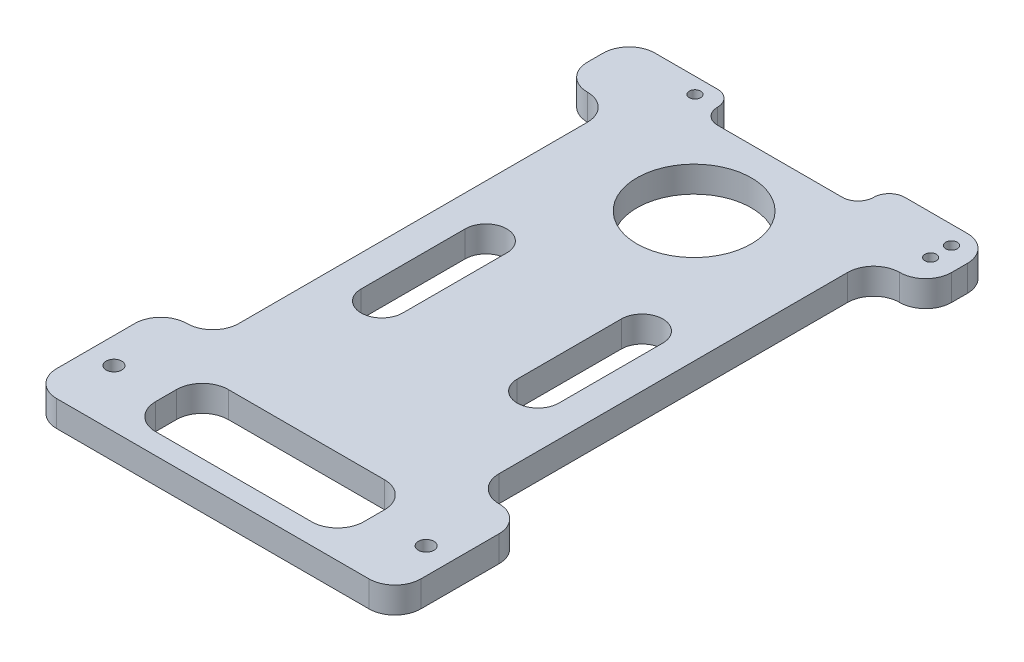
from build123d import *

# Parameters (mm, degrees)
SKETCH_1_W          = 70
SKETCH_1_H          = 115
SKETCH_1_R          = 1.5
SKETCH_1_R_2        = 1.1
SKETCH_1_R_3        = 11
SKETCH_1_W_2        = 40
SKETCH_1_H_2        = 14
EXTRUDE_1_DEPTH     = 5
FILLET_1_R          = 5
FILLET_2_R          = 5
SKETCH_3_W          = 30
SKETCH_3_H          = 6
SKETCH_3_W_2        = 10
SKETCH_3_H_2        = 77
CUT_EXTRUDE_1_DEPTH = 5
FILLET_START        = -1
FILLET_4_DEPTH      = 7
FILLET_4_2_DEPTH    = 5
FILLET_5_R          = 5
CUT_EXTRUDE_2_DEPTH = 10


with BuildPart() as part:
    # 草图1 → 凸台-拉伸1 (new body)
    with BuildSketch(Plane(origin=(0, 0, 0), x_dir=(1, 0, 0), z_dir=(0, 1, 0))):
        Rectangle(SKETCH_1_W, SKETCH_1_H)
        with Locations(Location((30, -46.5, 0), (0, 0, 270))):
            Circle(SKETCH_1_R, mode=Mode.SUBTRACT)
        with Locations(Location((-30, -46.5, 0), (0, 0, 270))):
            Circle(SKETCH_1_R, mode=Mode.SUBTRACT)
        with Locations(Location((30.5, 53.96, 0), (0, 0, 270))):
            Circle(SKETCH_1_R_2, mode=Mode.SUBTRACT)
        with Locations(Location((30.5, 49.96, 0), (0, 0, 270))):
            Circle(SKETCH_1_R_2, mode=Mode.SUBTRACT)
        with Locations(Location((-19.3, 54.46, 0), (0, 0, 270))):
            Circle(SKETCH_1_R_2, mode=Mode.SUBTRACT)
        with Locations(Location((0, 35, 0), (0, 0, 270))):
            Circle(SKETCH_1_R_3, mode=Mode.SUBTRACT)
        with Locations((0, -46.5)):
            Rectangle(SKETCH_1_W_2, SKETCH_1_H_2, mode=Mode.SUBTRACT)
    extrude(amount=EXTRUDE_1_DEPTH)

    # 圆角1
    fillet_1_edges = [part.edges().sort_by_distance(p)[0] for p in [
        (-35, 2.5, 57.5),
        (-35, 2.5, -57.5),
        (35, 2.5, -57.5),
        (35, 2.5, 57.5),
    ]]
    fillet(fillet_1_edges, radius=FILLET_1_R)

    # 圆角2
    fillet_2_edges = [part.edges().sort_by_distance(p)[0] for p in [
        (20, 2.5, 39.5),
        (-20, 2.5, 39.5),
        (-20, 2.5, 53.5),
        (20, 2.5, 53.5),
    ]]
    fillet(fillet_2_edges, radius=FILLET_2_R)

    # 草图3 → 切除-拉伸1 (cut)
    with BuildSketch(Plane(origin=(0, 5, 0), x_dir=(1, 0, 0), z_dir=(0, 1, 0))):
        with Locations((0, 54.5)):
            Rectangle(SKETCH_3_W, SKETCH_3_H)
        with Locations((30, 6)):
            Rectangle(SKETCH_3_W_2, SKETCH_3_H_2)
        with Locations((-30, 6)):
            Rectangle(SKETCH_3_W_2, SKETCH_3_H_2)
    extrude(amount=-CUT_EXTRUDE_1_DEPTH, mode=Mode.SUBTRACT)

    # 圆角4: read off the stored shape, not the designer's step
    # 圆角4 outline → 圆角4 (cut)
    with BuildSketch(Plane(origin=(0, 0, 0), x_dir=(1, 0, 0), z_dir=(0, 1, 0)).offset(FILLET_START)):
        with BuildLine():
            Line((15, 57.5), (15, 54.5))
            ThreePointArc((15, 54.5), (15.878679656, 56.621320344), (18, 57.5))
            Line((18, 57.5), (15, 57.5))
        make_face()
        with BuildLine():
            ThreePointArc((-18, 57.5), (-15.878679656, 56.621320344), (-15, 54.5))
            Line((-15, 54.5), (-15, 57.5))
            Line((-15, 57.5), (-18, 57.5))
        make_face()
    extrude(amount=FILLET_4_DEPTH, mode=Mode.SUBTRACT)

    # Fillet 4 2 outline → Fillet 4 2 (add)
    with BuildSketch(Plane(origin=(0, 0, 0), x_dir=(1, 0, 0), z_dir=(0, 1, 0))):
        with BuildLine():
            Line((15, 51.5), (15, 54.5))
            ThreePointArc((15, 54.5), (14.121320344, 52.378679656), (12, 51.5))
            Line((12, 51.5), (15, 51.5))
        make_face()
        with BuildLine():
            Line((-15, 51.5), (-12, 51.5))
            ThreePointArc((-12, 51.5), (-14.121320344, 52.378679656), (-15, 54.5))
            Line((-15, 54.5), (-15, 51.5))
        make_face()
    extrude(amount=FILLET_4_2_DEPTH)

    # 圆角5
    fillet_5_edges = [part.edges().sort_by_distance(p)[0] for p in [
        (-25, 2.5, 32.5),
        (25, 2.5, 32.5),
        (25, 2.5, -44.5),
        (-25, 2.5, -44.5),
    ]]
    fillet(fillet_5_edges, radius=FILLET_5_R)
    fillet_5_2_edges = [part.edges().sort_by_distance(p)[0] for p in [
        (-35, 2.5, 32.5),
        (35, 2.5, 32.5),
        (35, 2.5, -44.5),
        (-35, 2.5, -44.5),
    ]]
    fillet(fillet_5_2_edges, radius=FILLET_5_R - 0.0001)  # a hair under: the kernel refuses the full size

    # 草图4 → 切除-拉伸2 (cut)
    with BuildSketch(Plane(origin=(0, 5, 0), x_dir=(1, 0, 0), z_dir=(0, 1, 0))):
        with BuildLine():
            Line((11, -10), (11, 10))
            ThreePointArc((11, 10), (15, 14), (19, 10))
            Line((19, 10), (19, -10))
            ThreePointArc((19, -10), (15, -14), (11, -10))
        make_face()
        with BuildLine():
            Line((-11, -10), (-11, 10))
            ThreePointArc((-11, 10), (-15, 14), (-19, 10))
            Line((-19, 10), (-19, -10))
            ThreePointArc((-19, -10), (-15, -14), (-11, -10))
        make_face()
    extrude(amount=-CUT_EXTRUDE_2_DEPTH, mode=Mode.SUBTRACT)


solid = part.part
